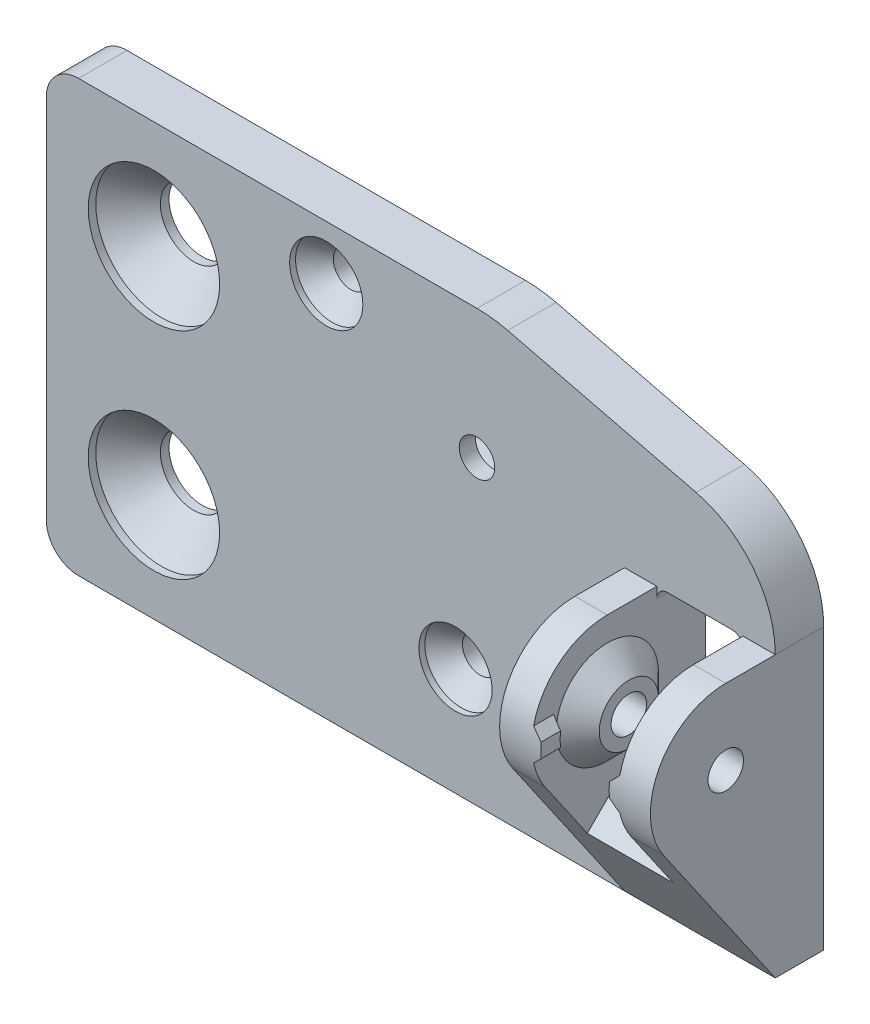
from build123d import *

# Parameters (mm, degrees)
SKETCH1_R           = 3.1
SKETCH1_R_2         = 1.65
BOSS_EXTRUDE1_DEPTH = 4.5
BOSS_EXTRUDE2_DEPTH = 15
BOSS_EXTRUDE3_DEPTH = 14
CUT_EXTRUDE1_DEPTH  = 11
SKETCH5_R           = 1.65
CUT_EXTRUDE2_DEPTH  = 73.405110317
CUT_EXTRUDE3_START  = -3
CUT_EXTRUDE3_DEPTH  = 8
FILLET1_R           = 5
SKETCH7_R           = 2.1
CUT_EXTRUDE4_DEPTH  = 47.44243749
SKETCH8_R           = 4.1
CUT_EXTRUDE5_DEPTH  = 1.5
CHAMFER1_SIZE       = 2
CUT_EXTRUDE6_DEPTH  = 64.154572281
CUT_EXTRUDE7_DEPTH  = 64.154572281
SKETCH11_R          = 1.65
CUT_EXTRUDE9_DEPTH  = 64.154572281
BOSS_EXTRUDE4_START = 2
SKETCH13_R          = 2.75
SKETCH13_R_2        = 1.65
BOSS_EXTRUDE4_DEPTH = 2
BOSS_EXTRUDE5_START = 0.825
BOSS_EXTRUDE5_DEPTH = 0.825
CHAMFER3_SIZE       = 2
SKETCH14_R          = 6.1
CUT_EXTRUDE10_DEPTH = 0.7
CHAMFER4_SIZE       = 3
CHAMFER5_SIZE       = 0.83
SKETCH16_R          = 3.4
CUT_EXTRUDE11_DEPTH = 0.5
CHAMFER6_SIZE       = 1.8
CUT_EXTRUDE12_DEPTH = 55.171025466
SKETCH18_R          = 6.25
CUT_EXTRUDE13_DEPTH = 3
FILLET2_R           = 1


# Some blends are built 0.0001 mm under size
with BuildPart() as part:
    # Sketch1 → Boss-Extrude1 (new body)
    with BuildSketch(Plane.XY):
        with BuildLine():
            Line((-10, 17), (-10, -17))
            ThreePointArc((-10, -17), (-9.121320344, -19.121320344), (-7, -20))
            Line((-7, -20), (57.7, -20))
            Line((57.7, -20), (57.7, 20))
            Line((57.7, 20), (10, 20))
            Line((10, 20), (-7, 20))
            ThreePointArc((-7, 20), (-9.121320344, 19.121320344), (-10, 17))
        make_face()
        with Locations((0, 10)):
            Circle(SKETCH1_R, mode=Mode.SUBTRACT)
        with Locations((0, -10)):
            Circle(SKETCH1_R, mode=Mode.SUBTRACT)
        with Locations((30, 8)):
            Circle(SKETCH1_R_2, mode=Mode.SUBTRACT)
    extrude(amount=BOSS_EXTRUDE1_DEPTH)

    # Sketch2 → Boss-Extrude2 (add)
    with BuildSketch(Plane.XZ.offset(20)):
        Polygon((10, 0), (10, -16), (19, -16), (57.7, 0), align=None)
    extrude(amount=-BOSS_EXTRUDE2_DEPTH)

    # Sketch3 → Boss-Extrude3 (add)
    with BuildSketch(Plane(origin=(57.7, 0, 0), x_dir=(0, 0, -1), z_dir=(1, 0, 0))):
        with BuildLine():
            Line((-9.1, 6), (-4.5, 6))
            Line((-4.5, 6), (-4.5, -20))
            Line((-4.5, -20), (-14.862521583, -4.974084173))
            ThreePointArc((-14.862521583, -4.974084173), (-15.297523264, 2.254336399), (-9.1, 6))
        make_face()
    extrude(amount=-BOSS_EXTRUDE3_DEPTH)

    # Sketch4 → Cut-Extrude1 (cut)
    with BuildSketch(Plane(origin=(0, -5, 0), x_dir=(1, 0, 0), z_dir=(0, 1, 0))):
        Polygon((10, 0), (57.7, 0), (57.7, 16), (19, 16), (19, 5.1), (10, 5.1), align=None)
    extrude(amount=-CUT_EXTRUDE1_DEPTH, mode=Mode.SUBTRACT)

    # Sketch5 → Cut-Extrude2 (cut, through all)
    with BuildSketch(Plane(origin=(57.7, 0, 0), x_dir=(0, 0, -1), z_dir=(1, 0, 0))):
        with Locations(Location((-9.1, -1, 0), (0, 0, 90))):
            Circle(SKETCH5_R)
    extrude(amount=-CUT_EXTRUDE2_DEPTH, mode=Mode.SUBTRACT)

    # Sketch6 → Cut-Extrude3 (cut)
    with BuildSketch(Plane(origin=(57.7, 0, 0), x_dir=(0, 0, -1), z_dir=(1, 0, 0)).offset(CUT_EXTRUDE3_START)):
        with BuildLine():
            Line((-5.210912703, -4.889087297), (-19.214201662, -18.892376255))
            Line((-19.214201662, -18.892376255), (-19.214201662, 16.892376255))
            Line((-19.214201662, 16.892376255), (-5.210912703, 2.889087297))
            ThreePointArc((-5.210912703, 2.889087297), (-3.6, -1), (-5.210912703, -4.889087297))
        make_face()
    extrude(amount=-CUT_EXTRUDE3_DEPTH, mode=Mode.SUBTRACT)

    # Fillet1
    fillet1_edges = [part.edges().sort_by_distance(p)[0] for p in [
        (14.5, -5, -16),
    ]]
    fillet(fillet1_edges, radius=FILLET1_R)

    # Sketch7 → Cut-Extrude4 (cut, through all)
    with BuildSketch(Plane(origin=(19, 0, 0), x_dir=(0, 0, -1), z_dir=(1, 0, 0))):
        with Locations(Location((11, -10, 0), (0, 0, 90))):
            Circle(SKETCH7_R)
    extrude(amount=-CUT_EXTRUDE4_DEPTH, mode=Mode.SUBTRACT)

    # Sketch8 → Cut-Extrude5 (cut)
    with BuildSketch(Plane(origin=(19, 0, 0), x_dir=(0, 0, -1), z_dir=(1, 0, 0))):
        with Locations(Location((11, -10, 0), (0, 0, 90))):
            Circle(SKETCH8_R)
    extrude(amount=-CUT_EXTRUDE5_DEPTH, mode=Mode.SUBTRACT)

    # Chamfer1
    chamfer1_edges = [part.edges().sort_by_distance(p)[0] for p in [
        (17.5, -12.1, -11),
    ]]
    chamfer(chamfer1_edges, length=CHAMFER1_SIZE - 0.0001)  # a hair under: the kernel refuses the full size

    # Sketch9 → Cut-Extrude6 (cut, through all)
    with BuildSketch(Plane.XY):
        Polygon((46.7, 6), (54.7, 6), (54.7, 3.5), (54.7, -5.5), (54.7, -8), (46.7, -8), (46.7, -5.5), (46.7, 3.5), align=None)
    extrude(amount=CUT_EXTRUDE6_DEPTH, mode=Mode.SUBTRACT)

    # Sketch10 → Cut-Extrude7 (cut, through all)
    with BuildSketch(Plane(origin=(0, 0, 0), x_dir=(-1, 0, 0), z_dir=(0, 0, -1))):
        with BuildLine():
            Line((-57.7, 6), (-57.7, 20))
            Line((-57.7, 20), (-30, 20))
            ThreePointArc((-30, 20), (-31.436169615, 19.913749067), (-32.851694068, 19.65623614))
            Line((-32.851694068, 19.65623614), (-50.33995445, 15.377739394))
            ThreePointArc((-50.33995445, 15.377739394), (-55.640268278, 11.96054248), (-57.7, 6))
        make_face()
    extrude(amount=-CUT_EXTRUDE7_DEPTH, mode=Mode.SUBTRACT)

    # Sketch11 → Cut-Extrude9 (cut, through all)
    with BuildSketch(Plane(origin=(0, 0, 0), x_dir=(-1, 0, 0), z_dir=(0, 0, -1))):
        with Locations((-16, 15)):
            Circle(SKETCH11_R)
        with Locations((-28, -10)):
            Circle(SKETCH11_R)
    extrude(amount=-CUT_EXTRUDE9_DEPTH, mode=Mode.SUBTRACT)

    # Sketch13 → Boss-Extrude4 (add)
    with BuildSketch(Plane(origin=(46.7, 0, 0), x_dir=(0, 0, -1), z_dir=(1, 0, 0)).offset(BOSS_EXTRUDE4_START)):
        with Locations(Location((-9.1, -1, 0), (0, 0, 90))):
            Circle(SKETCH13_R)
        with Locations(Location((-9.1, -1, 0), (0, 0, 90))):
            Circle(SKETCH13_R_2, mode=Mode.SUBTRACT)
    boss_extrude4 = extrude(amount=-BOSS_EXTRUDE4_DEPTH)

    # Sketch15 → Boss-Extrude5 (add)
    with BuildSketch(Plane(origin=(46.7, 0, 0), x_dir=(0, 0, -1), z_dir=(1, 0, 0)).offset(BOSS_EXTRUDE5_START)):
        with BuildLine():
            Line((-14.078955714, 0.5), (-15.937397166, 0.5))
            ThreePointArc((-15.937397166, 0.5), (-16.1, -1), (-15.937397166, -2.5))
            Line((-15.937397166, -2.5), (-14.078955714, -2.5))
            ThreePointArc((-14.078955714, -2.5), (-14.3, -1), (-14.078955714, 0.5))
        make_face()
    boss_extrude5 = extrude(amount=-BOSS_EXTRUDE5_DEPTH)

    # Mirror1: Boss-Extrude4, Boss-Extrude5 across plane
    add(boss_extrude4.mirror(Plane(origin=(50.7, 0, 0), x_dir=(0, 0, 1), z_dir=(1, 0, 0))))
    add(boss_extrude5.mirror(Plane(origin=(50.7, 0, 0), x_dir=(0, 0, 1), z_dir=(1, 0, 0))))

    # Chamfer3
    chamfer3_edges = [part.edges().sort_by_distance(p)[0] for p in [
        (46.7, -3.75, 9.1),
        (54.7, -3.75, 9.1),
    ]]
    chamfer(chamfer3_edges, length=CHAMFER3_SIZE - 0.0001)  # a hair under: the kernel refuses the full size

    # Sketch14 → Cut-Extrude10 (cut)
    with BuildSketch(Plane(origin=(0, 0, 4.5), x_dir=(-1, 0, 0), z_dir=(0, 0, -1))):
        with Locations((0, -10)):
            Circle(SKETCH14_R)
        with Locations((0, 10)):
            Circle(SKETCH14_R)
    extrude(amount=CUT_EXTRUDE10_DEPTH, mode=Mode.SUBTRACT)

    # Chamfer4
    chamfer4_edges = [part.edges().sort_by_distance(p)[0] for p in [
        (-3.1, -10, 3.8),
        (-3.1, 10, 3.8),
    ]]
    chamfer(chamfer4_edges, length=CHAMFER4_SIZE - 0.0001)  # a hair under: the kernel refuses the full size

    # Chamfer5
    # the kernel refuses this chamfer: 0.83 mm, written as the material it takes off along each edge
    with BuildSketch(Plane(origin=(53.875, -2.5, 18.071894046), x_dir=(0.9996219169112968, -0.027495876610586414, 0), z_dir=(0, 0, -1))) as chamfer5_piece_1_section:
        Polygon((CHAMFER5_SIZE * 0.999621916911, -CHAMFER5_SIZE * 0.0274958766106), (-CHAMFER5_SIZE * 0.0274958766106, -CHAMFER5_SIZE * 0.999621916911), (0, 0), align=None)
    chamfer5_piece_1 = extrude(amount=6.127435212, mode=Mode.PRIVATE)
    chamfer5_piece_1 = split(chamfer5_piece_1, bisect_by=Plane(origin=(54.7, -2.224603208, 15.069483683), z_dir=(-1, 0, 0)), keep=Keep.TOP, mode=Mode.PRIVATE)
    chamfer5_piece_1 = chamfer5_piece_1 - Plane(origin=(54.15228648, -1, 9.1), x_dir=(0, -0.2884615384615384, 0.957491483423431), z_dir=(-1, 0, 0)) * Cylinder(5.2, 16, mode=Mode.PRIVATE)
    add(chamfer5_piece_1, mode=Mode.SUBTRACT)
    with BuildSketch(Plane(origin=(53.875, 0.5, 11.944458834), x_dir=(0.9996219169112968, 0.027495876610586546, 0), z_dir=(0, 0, 1))) as chamfer5_piece_2_section:
        Polygon((CHAMFER5_SIZE * 0.999621916911, -CHAMFER5_SIZE * 0.0274958766106), (-CHAMFER5_SIZE * 0.0274958766106, -CHAMFER5_SIZE * 0.999621916911), (0, 0), align=None)
    chamfer5_piece_2 = extrude(amount=6.127435212, mode=Mode.PRIVATE)
    chamfer5_piece_2 = split(chamfer5_piece_2, bisect_by=Plane(origin=(54.7, 0.224603208, 15.069483683), z_dir=(-1, 0, 0)), keep=Keep.TOP, mode=Mode.PRIVATE)
    chamfer5_piece_2 = chamfer5_piece_2 - Plane(origin=(54.15228648, -1, 9.1), x_dir=(0, -0.2884615384615384, 0.957491483423431), z_dir=(-1, 0, 0)) * Cylinder(5.2, 16, mode=Mode.PRIVATE)
    add(chamfer5_piece_2, mode=Mode.SUBTRACT)
    with BuildSketch(Plane(origin=(47.525, -2.5, 18.071894046), x_dir=(-0.9996219169112968, -0.027495876610586414, 0), z_dir=(0, 0, -1))) as chamfer5_piece_3_section:
        Polygon((CHAMFER5_SIZE * 0.999621916911, CHAMFER5_SIZE * 0.0274958766106), (-CHAMFER5_SIZE * 0.0274958766106, CHAMFER5_SIZE * 0.999621916911), (0, 0), align=None)
    chamfer5_piece_3 = extrude(amount=6.127435212, mode=Mode.PRIVATE)
    chamfer5_piece_3 = split(chamfer5_piece_3, bisect_by=Plane(origin=(46.7, -2.224603208, 15.069483683), z_dir=(1, 0, 0)), keep=Keep.TOP, mode=Mode.PRIVATE)
    chamfer5_piece_3 = chamfer5_piece_3 - Plane(origin=(47.24771352, -1, 9.1), x_dir=(0, -0.2884615384615384, 0.957491483423431), z_dir=(1, 0, 0)) * Cylinder(5.2, 16, mode=Mode.PRIVATE)
    add(chamfer5_piece_3, mode=Mode.SUBTRACT)
    with BuildSketch(Plane(origin=(47.525, 0.5, 11.944458834), x_dir=(-0.9996219169112968, 0.027495876610586285, 0), z_dir=(0, 0, 1))) as chamfer5_piece_4_section:
        Polygon((CHAMFER5_SIZE * 0.999621916911, CHAMFER5_SIZE * 0.0274958766106), (-CHAMFER5_SIZE * 0.0274958766106, CHAMFER5_SIZE * 0.999621916911), (0, 0), align=None)
    chamfer5_piece_4 = extrude(amount=6.127435212, mode=Mode.PRIVATE)
    chamfer5_piece_4 = split(chamfer5_piece_4, bisect_by=Plane(origin=(46.7, 0.224603208, 15.069483683), z_dir=(1, 0, 0)), keep=Keep.TOP, mode=Mode.PRIVATE)
    chamfer5_piece_4 = chamfer5_piece_4 - Plane(origin=(47.24771352, -1, 9.1), x_dir=(0, -0.2884615384615384, 0.957491483423431), z_dir=(1, 0, 0)) * Cylinder(5.2, 16, mode=Mode.PRIVATE)
    add(chamfer5_piece_4, mode=Mode.SUBTRACT)

    # Sketch16 → Cut-Extrude11 (cut)
    with BuildSketch(Plane(origin=(0, 0, 4.5), x_dir=(-1, 0, 0), z_dir=(0, 0, -1))):
        with Locations((-28, -10)):
            Circle(SKETCH16_R)
        with Locations((-16, 15)):
            Circle(SKETCH16_R)
    extrude(amount=CUT_EXTRUDE11_DEPTH, mode=Mode.SUBTRACT)

    # Chamfer6
    # the kernel refuses this chamfer: 1.8 mm, written as the material it takes off along each edge
    with BuildSketch(Plane(origin=(28, -10, 4), x_dir=(-1, 0, 0), z_dir=(0, -1, 0))) as chamfer6_piece_1_section:
        Polygon((1.65, CHAMFER6_SIZE), (1.65 + CHAMFER6_SIZE, 0), (1.65, 0), align=None)
    chamfer6_piece_1 = revolve(axis=Axis((28, -10, 4), (0, 0, -1)), mode=Mode.PRIVATE)
    chamfer6_piece_1 = chamfer6_piece_1 & Plane(origin=(28, -10, 3.070206715), x_dir=(-1, 0, 0), z_dir=(0, 0, 1)) * Cylinder(3.4, 14, mode=Mode.PRIVATE)
    add(chamfer6_piece_1, mode=Mode.SUBTRACT)
    with BuildSketch(Plane(origin=(16, 15, 4), x_dir=(-1, 0, 0), z_dir=(0, -1, 0))) as chamfer6_piece_2_section:
        Polygon((1.65, CHAMFER6_SIZE), (1.65 + CHAMFER6_SIZE, 0), (1.65, 0), align=None)
    chamfer6_piece_2 = revolve(axis=Axis((16, 15, 4), (0, 0, -1)), mode=Mode.PRIVATE)
    chamfer6_piece_2 = chamfer6_piece_2 & Plane(origin=(16, 15, 3.070206715), x_dir=(-1, 0, 0), z_dir=(0, 0, 1)) * Cylinder(3.4, 14, mode=Mode.PRIVATE)
    add(chamfer6_piece_2, mode=Mode.SUBTRACT)

    # Sketch17 → Cut-Extrude12 (cut, through all)
    with BuildSketch(Plane.ZY.offset(-10)):
        Polygon((-11, -10), (-9.51507576, -8.51507576), (-10.550151519, -7.48), (-11.449848481, -7.48), (-12.48492424, -8.51507576), align=None)
    extrude(amount=-CUT_EXTRUDE12_DEPTH, mode=Mode.SUBTRACT)

    # Sketch18 → Cut-Extrude13 (cut)
    with BuildSketch(Plane(origin=(0, 0, 0), x_dir=(-1, 0, 0), z_dir=(0, 0, -1))):
        with Locations((-30, 8)):
            Circle(SKETCH18_R)
    extrude(amount=-CUT_EXTRUDE13_DEPTH, mode=Mode.SUBTRACT)

    # Fillet2
    fillet2_edges = [part.edges().sort_by_distance(p)[0] for p in [
        (46.7, 6, 2.25),
        (54.7, 6, 2.25),
    ]]
    fillet(fillet2_edges, radius=FILLET2_R)


solid = part.part
